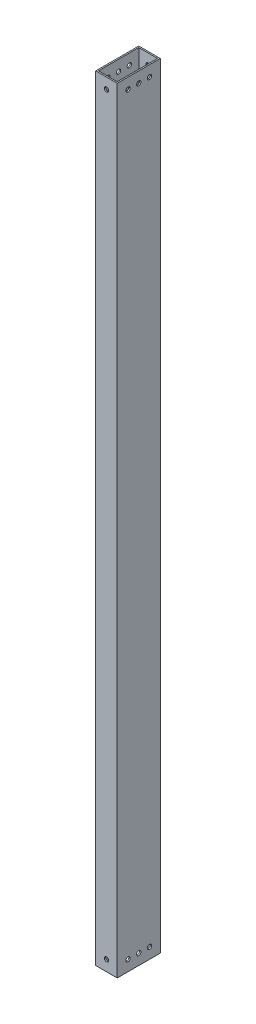
from build123d import *

# Parameters (mm, degrees)
SKETCH1_W              = 25.4
SKETCH1_H              = 50.8
SKETCH1_W_2            = 22.225
SKETCH1_H_2            = 47.625
EXTRUDE_THIN1_DEPTH    = 914.4
F_10_CLEARANCE_HOLE1_D = 5.1054
F_10_CLEARANCE_HOLE2_D = 5.1054


with BuildPart() as part:
    # Sketch1 → Extrude-Thin1 (new body)
    with BuildSketch(Plane(origin=(0, 0, 0), x_dir=(1, 0, 0), z_dir=(0, 1, 0))):
        Rectangle(SKETCH1_W, SKETCH1_H)
        Rectangle(SKETCH1_W_2, SKETCH1_H_2, mode=Mode.SUBTRACT)
    extrude(amount=EXTRUDE_THIN1_DEPTH)

    # #10 Clearance Hole1 (through all)
    with Locations(Plane.ZY.offset(12.7)):
        with Locations((-12.7, 901.7), (0, 901.7), (12.7, 901.7), (-12.7, 12.7), (0, 12.7), (12.7, 12.7)):
            Hole(F_10_CLEARANCE_HOLE1_D / 2)

    # #10 Clearance Hole2 (through all)
    with Locations(Plane.XY.offset(25.4)):
        with Locations((0, 901.7), (0, 12.7)):
            Hole(F_10_CLEARANCE_HOLE2_D / 2)


solid = part.part
